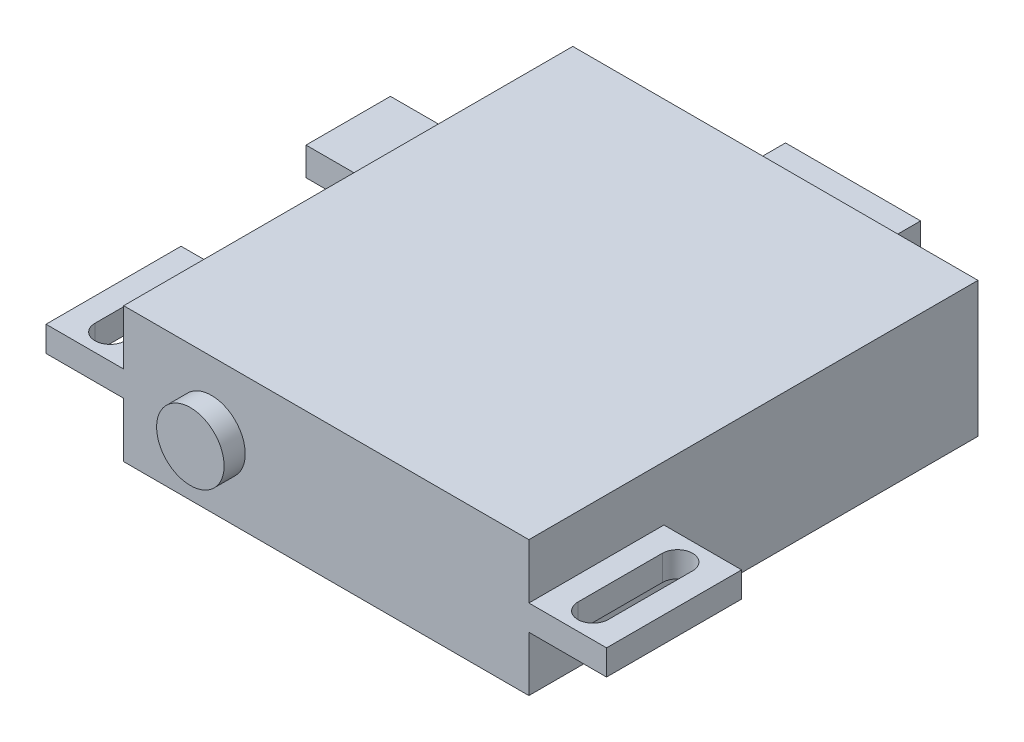
from build123d import *

# Parameters (mm, degrees)
SKETCH1_W           = 30.48
SKETCH1_H           = 33.782
BOSS_EXTRUDE1_DEPTH = 5.08
SKETCH2_R           = 2.54
BOSS_EXTRUDE2_DEPTH = 1.5875
SKETCH3_W           = 5.842
SKETCH3_H           = 10.16
BOSS_EXTRUDE3_DEPTH = 0.9525
SKETCH4_W           = 10.16
SKETCH4_H           = 5.842
BOSS_EXTRUDE4_DEPTH = 0.9525
SKETCH5_W           = 6.35
SKETCH5_H           = 2.131234452
BOSS_EXTRUDE5_DEPTH = 7.62


with BuildPart() as part:
    # Sketch1 → Boss-Extrude1 (new, symmetric)
    with BuildSketch(Plane(origin=(0, 0, 0), x_dir=(1, 0, 0), z_dir=(0, 1, 0))):
        Rectangle(SKETCH1_W, SKETCH1_H)
    extrude(amount=BOSS_EXTRUDE1_DEPTH, both=True)

    # Sketch2 → Boss-Extrude2 (add, symmetric)
    with BuildSketch(Plane.XY.offset(16.891)):
        with Locations((-8.636, 0)):
            Circle(SKETCH2_R)
    extrude(amount=BOSS_EXTRUDE2_DEPTH, both=True)

    # Sketch3 → Boss-Extrude3 (add, symmetric)
    with BuildSketch(Plane(origin=(0, 0, 0), x_dir=(1, 0, 0), z_dir=(0, 1, 0))):
        with Locations((18.161, -11.811)):
            Rectangle(SKETCH3_W, SKETCH3_H)
        with BuildLine():
            Line((19.304, -8.636), (19.304, -14.986))
            ThreePointArc((19.304, -14.986), (18.161, -16.129), (17.018, -14.986))
            Line((17.018, -14.986), (17.018, -8.636))
            ThreePointArc((17.018, -8.636), (18.161, -7.493), (19.304, -8.636))
        make_face(mode=Mode.SUBTRACT)
    boss_extrude3 = extrude(amount=BOSS_EXTRUDE3_DEPTH, both=True)

    # Mirror1: Boss-Extrude3 across plane
    add(boss_extrude3.mirror(Plane(origin=(0, 0, 0), x_dir=(0, 0, 1), z_dir=(1, 0, 0))))

    # Sketch4 → Boss-Extrude4 (add, symmetric)
    with BuildSketch(Plane(origin=(0, 0, 0), x_dir=(1, 0, 0), z_dir=(0, 1, 0))):
        with Locations((0, 19.812)):
            Rectangle(SKETCH4_W, SKETCH4_H)
        with BuildLine():
            Line((-3.175, 20.955), (3.175, 20.955))
            ThreePointArc((3.175, 20.955), (4.318, 19.812), (3.175, 18.669))
            Line((3.175, 18.669), (-3.175, 18.669))
            ThreePointArc((-3.175, 18.669), (-4.318, 19.812), (-3.175, 20.955))
        make_face(mode=Mode.SUBTRACT)
    extrude(amount=BOSS_EXTRUDE4_DEPTH, both=True)

    # Sketch5 → Boss-Extrude5 (add)
    with BuildSketch(Plane.ZY.offset(15.24)):
        with Locations((-7.62, 0)):
            Rectangle(SKETCH5_W, SKETCH5_H)
    extrude(amount=BOSS_EXTRUDE5_DEPTH)


solid = part.part
